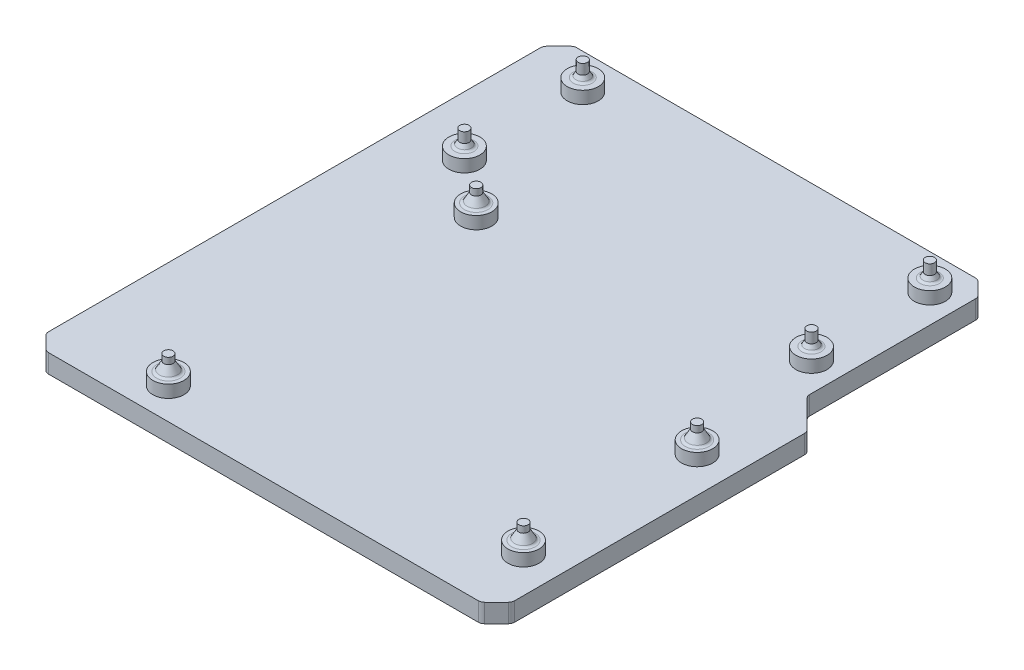
from build123d import *
from OCP.BRepFilletAPI import BRepFilletAPI_MakeChamfer

# Parameters (mm, degrees)
SKETCH1_W           = 75
SKETCH1_H           = 85
BOSS_EXTRUDE1_DEPTH = 3
SKETCH2_R           = 2.5
BOSS_EXTRUDE2_DEPTH = 2
SKETCH3_R           = 0.75
BOSS_EXTRUDE3_DEPTH = 2.5
CHAMFER1_SIZE       = 0.5
CHAMFER1_SIZE2      = 0.866025404
CHAMFER2_SIZE       = 0.85
CHAMFER2_SIZE2      = 1.472243186
FILLET1_R           = 0.5
CUT_EXTRUDE1_REACH  = 58.857
CHAMFER3_SIZE       = 2.5
FILLET2_R           = 1


with BuildPart() as part:
    # Sketch1 → Boss-Extrude1 (new body)
    with BuildSketch(Plane(origin=(0, 0, 0), x_dir=(1, 0, 0), z_dir=(0, 1, 0))):
        Rectangle(SKETCH1_W, SKETCH1_H)
    extrude(amount=BOSS_EXTRUDE1_DEPTH)

    # Sketch2 → Boss-Extrude2 (add)
    with BuildSketch(Plane(origin=(0, 3, 0), x_dir=(1, 0, 0), z_dir=(0, 1, 0))):
        with Locations((27.93, 36.82)):
            Circle(SKETCH2_R)
        with Locations((27.93, 17.77)):
            Circle(SKETCH2_R)
        with Locations((-27.93, 17.77)):
            Circle(SKETCH2_R)
        with Locations((-27.93, 36.82)):
            Circle(SKETCH2_R)
        with Locations((-19.05, 10.79)):
            Circle(SKETCH2_R)
        with Locations((-20.32, -37.48)):
            Circle(SKETCH2_R)
        with Locations((31.75, -4.45)):
            Circle(SKETCH2_R)
        with Locations((31.75, -32.4)):
            Circle(SKETCH2_R)
    extrude(amount=BOSS_EXTRUDE2_DEPTH)

    # Sketch3 → Boss-Extrude3 (add)
    with BuildSketch(Plane(origin=(0, 5, 0), x_dir=(1, 0, 0), z_dir=(0, 1, 0))):
        with Locations((-27.93, 36.82)):
            Circle(SKETCH3_R)
        with Locations((27.93, 36.82)):
            Circle(SKETCH3_R)
        with Locations((27.93, 17.77)):
            Circle(SKETCH3_R)
        with Locations((-27.93, 17.77)):
            Circle(SKETCH3_R)
        with Locations((-19.05, 10.79)):
            Circle(SKETCH3_R)
        with Locations((31.75, -4.45)):
            Circle(SKETCH3_R)
        with Locations((-20.32, -37.48)):
            Circle(SKETCH3_R)
        with Locations((31.75, -32.4)):
            Circle(SKETCH3_R)
    extrude(amount=BOSS_EXTRUDE3_DEPTH)

    # Chamfer1: one chamfer whose edges measure the first distance from different faces: ONE call of the kernel's chamfer builder (chamfer() names one face for all edges)
    chamfer1_edges_1 = [part.edges().sort_by_distance(p)[0] for p in [
        (27.18, 5, -17.77),
    ]]
    chamfer1_side_1 = [part.faces().sort_by_distance(p)[0] for p in [
        (25.500710678, 5, -17.77),
    ]]
    chamfer1_edges_2 = [part.edges().sort_by_distance(p)[0] for p in [
        (27.18, 5, -36.82),
    ]]
    chamfer1_side_2 = [part.faces().sort_by_distance(p)[0] for p in [
        (25.500710678, 5, -36.82),
    ]]
    chamfer1_edges_3 = [part.edges().sort_by_distance(p)[0] for p in [
        (-28.68, 5, -36.82),
    ]]
    chamfer1_side_3 = [part.faces().sort_by_distance(p)[0] for p in [
        (-30.359289322, 5, -36.82),
    ]]
    chamfer1_edges_4 = [part.edges().sort_by_distance(p)[0] for p in [
        (-28.68, 5, -17.77),
    ]]
    chamfer1_side_4 = [part.faces().sort_by_distance(p)[0] for p in [
        (-30.359289322, 5, -17.77),
    ]]
    chamfer1 = BRepFilletAPI_MakeChamfer(part.part.solid().wrapped)
    for e in chamfer1_edges_1:
        chamfer1.Add(CHAMFER1_SIZE, CHAMFER1_SIZE2, e.wrapped, chamfer1_side_1[0].wrapped)  # the first distance lies on this face
    for e in chamfer1_edges_2:
        chamfer1.Add(CHAMFER1_SIZE, CHAMFER1_SIZE2, e.wrapped, chamfer1_side_2[0].wrapped)  # the first distance lies on this face
    for e in chamfer1_edges_3:
        chamfer1.Add(CHAMFER1_SIZE, CHAMFER1_SIZE2, e.wrapped, chamfer1_side_3[0].wrapped)  # the first distance lies on this face
    for e in chamfer1_edges_4:
        chamfer1.Add(CHAMFER1_SIZE, CHAMFER1_SIZE2, e.wrapped, chamfer1_side_4[0].wrapped)  # the first distance lies on this face
    add(Compound.cast(chamfer1.Shape()), mode=Mode.REPLACE)

    # Chamfer2: one chamfer whose edges measure the first distance from different faces: ONE call of the kernel's chamfer builder (chamfer() names one face for all edges)
    chamfer2_edges_1 = [part.edges().sort_by_distance(p)[0] for p in [
        (31, 5, 4.45),
    ]]
    chamfer2_side_1 = [part.faces().sort_by_distance(p)[0] for p in [
        (29.320710678, 5, 4.45),
    ]]
    chamfer2_edges_2 = [part.edges().sort_by_distance(p)[0] for p in [
        (31, 5, 32.4),
    ]]
    chamfer2_side_2 = [part.faces().sort_by_distance(p)[0] for p in [
        (29.320710678, 5, 32.4),
    ]]
    chamfer2_edges_3 = [part.edges().sort_by_distance(p)[0] for p in [
        (-21.07, 5, 37.48),
    ]]
    chamfer2_side_3 = [part.faces().sort_by_distance(p)[0] for p in [
        (-22.749289322, 5, 37.48),
    ]]
    chamfer2_edges_4 = [part.edges().sort_by_distance(p)[0] for p in [
        (-19.8, 5, -10.79),
    ]]
    chamfer2_side_4 = [part.faces().sort_by_distance(p)[0] for p in [
        (-21.479289322, 5, -10.79),
    ]]
    chamfer2 = BRepFilletAPI_MakeChamfer(part.part.solid().wrapped)
    for e in chamfer2_edges_1:
        chamfer2.Add(CHAMFER2_SIZE, CHAMFER2_SIZE2, e.wrapped, chamfer2_side_1[0].wrapped)  # the first distance lies on this face
    for e in chamfer2_edges_2:
        chamfer2.Add(CHAMFER2_SIZE, CHAMFER2_SIZE2, e.wrapped, chamfer2_side_2[0].wrapped)  # the first distance lies on this face
    for e in chamfer2_edges_3:
        chamfer2.Add(CHAMFER2_SIZE, CHAMFER2_SIZE2, e.wrapped, chamfer2_side_3[0].wrapped)  # the first distance lies on this face
    for e in chamfer2_edges_4:
        chamfer2.Add(CHAMFER2_SIZE, CHAMFER2_SIZE2, e.wrapped, chamfer2_side_4[0].wrapped)  # the first distance lies on this face
    add(Compound.cast(chamfer2.Shape()), mode=Mode.REPLACE)

    # Fillet1
    fillet1_edges = [part.edges().sort_by_distance(p)[0] for p in [
        (26.68, 5, -36.82),
        (26.68, 5, -17.77),
        (-29.18, 5, -17.77),
        (-29.18, 5, -36.82),
        (-20.65, 5, -10.79),
        (30.15, 5, 32.4),
        (-21.92, 5, 37.48),
        (30.15, 5, 4.45),
    ]]
    fillet(fillet1_edges, radius=FILLET1_R)

    # Sketch4 → Cut-Extrude1 (cut, up to next)
    with BuildSketch(Plane(origin=(0, 3, 0), x_dir=(1, 0, 0), z_dir=(0, 1, 0)), mode=Mode.PRIVATE) as cut_extrude1_sk1:
        Polygon((37.5, 7.5), (32.5, 12.5), (32.5, 42.5), (37.5, 42.5), align=None)
    cut_extrude1_tool1 = extrude(cut_extrude1_sk1.sketch, amount=-CUT_EXTRUDE1_REACH, mode=Mode.PRIVATE) & part.part
    add(cut_extrude1_tool1.solids().sort_by_distance((35.064103, 3, -26.217949))[0], mode=Mode.SUBTRACT)

    # Chamfer3
    chamfer3_edges = [part.edges().sort_by_distance(p)[0] for p in [
        (-37.5, 1.5, 42.5),
        (-37.5, 1.5, -42.5),
        (37.5, 1.5, 42.5),
        (32.5, 1.5, -42.5),
    ]]
    chamfer(chamfer3_edges, length=CHAMFER3_SIZE)

    # Fillet2
    fillet2_edges = [part.edges().sort_by_distance(p)[0] for p in [
        (-37.5, 1.5, -40),
        (-35, 1.5, -42.5),
        (30, 1.5, -42.5),
        (32.5, 1.5, -40),
        (32.5, 1.5, -12.5),
        (37.5, 1.5, -7.5),
        (37.5, 1.5, 40),
        (35, 1.5, 42.5),
        (-37.5, 1.5, 40),
        (-35, 1.5, 42.5),
    ]]
    fillet(fillet2_edges, radius=FILLET2_R)


solid = part.part
